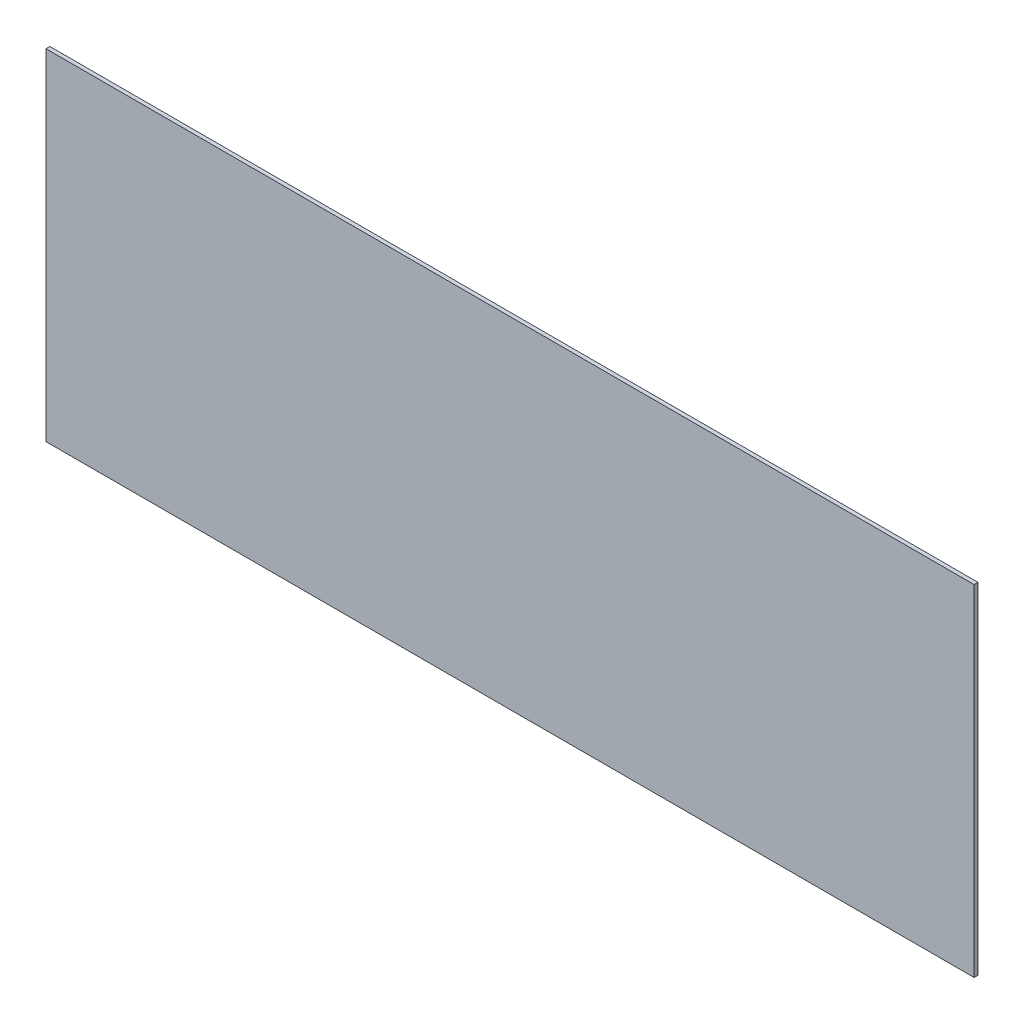
from build123d import *

# Parameters (mm, degrees)
SKETCH1_W           = 762
SKETCH1_H           = 279.4
BOSS_EXTRUDE1_DEPTH = 3.175


with BuildPart() as part:
    # Sketch1 → Boss-Extrude1 (new body)
    with BuildSketch(Plane.XY):
        Rectangle(SKETCH1_W, SKETCH1_H)
    extrude(amount=BOSS_EXTRUDE1_DEPTH)


solid = part.part
